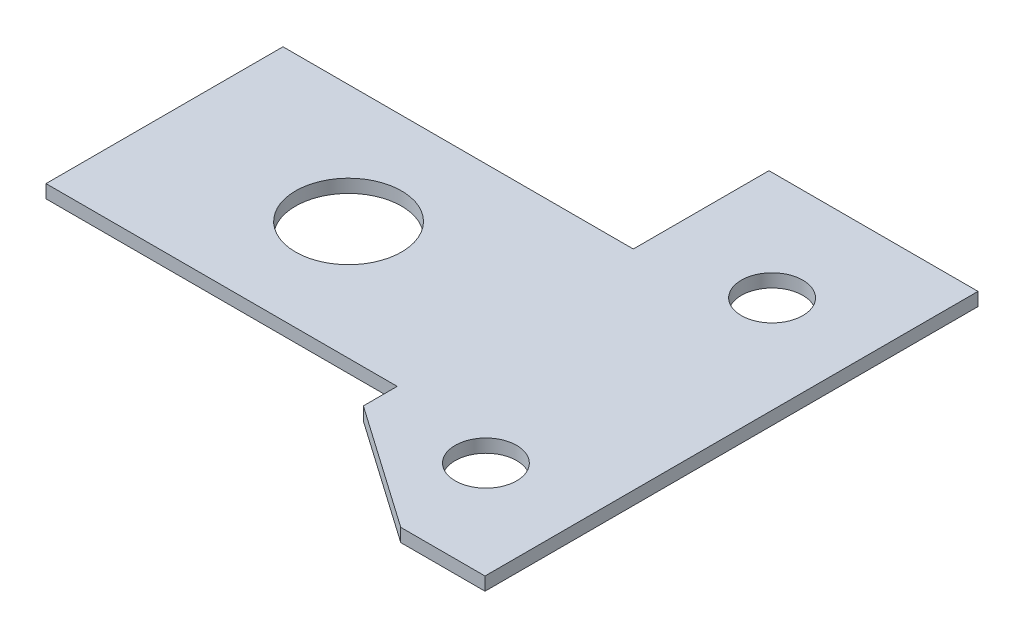
from build123d import *

# Parameters (mm, degrees)
BASE_FLANGE1_DEPTH = 1.016
SKETCH6_R          = 4.075
CUT_EXTRUDE1_DEPTH = 52.680313041
CUT_EXTRUDE2_REACH = 53.68
CUT_EXTRUDE3_REACH = 53.68
SKETCH8_R          = 2.36295848


# Sheet-metal steps are written as plain solids
with BuildPart() as part:
    # Sketch1 → Base-Flange1 (new body)
    with BuildSketch(Plane(origin=(0, 0, 0), x_dir=(1, 0, 0), z_dir=(0, 1, 0))):
        Polygon((27, 0), (27, -9.25), (43, -9.25), (43, -1.78), (43, 18.22), (43, 28.65), (26.93, 28.65), (26.93, 18.22), (0, 18.22), (0, 0), align=None)
    extrude(amount=-BASE_FLANGE1_DEPTH)

    # Sketch6 → Cut-Extrude1 (cut, through all)
    with BuildSketch(Plane(origin=(0, 0, 0), x_dir=(1, 0, 0), z_dir=(0, 1, 0))):
        with Locations(Location((14.15, 9.11, 0), (0, 0, 270))):
            Circle(SKETCH6_R)
    extrude(amount=-CUT_EXTRUDE1_DEPTH, mode=Mode.SUBTRACT)

    # Sketch7 → Cut-Extrude2 (cut, up to next)
    with BuildSketch(Plane(origin=(0, 0, 0), x_dir=(1, 0, 0), z_dir=(0, 1, 0)), mode=Mode.PRIVATE) as cut_extrude2_sk1:
        Polygon((36.522343865, -9.25), (27, -2.599722771), (27, -9.25), align=None)
    cut_extrude2_tool1 = extrude(cut_extrude2_sk1.sketch, amount=-CUT_EXTRUDE2_REACH, mode=Mode.PRIVATE) & part.part
    add(cut_extrude2_tool1.solids().sort_by_distance((30.174115, 0, 7.033241))[0], mode=Mode.SUBTRACT)

    # Sketch8 → Cut-Extrude3 (cut, up to next)
    with BuildSketch(Plane(origin=(0, 0, 0), x_dir=(1, 0, 0), z_dir=(0, 1, 0)), mode=Mode.PRIVATE) as cut_extrude3_sk1:
        with Locations(Location((35.518210435, -1.697952117, 0), (0, 0, 270))):
            Circle(SKETCH8_R)
    cut_extrude3_tool1 = extrude(cut_extrude3_sk1.sketch, amount=-CUT_EXTRUDE3_REACH, mode=Mode.PRIVATE) & part.part
    # Sketch8 → Cut-Extrude3 (cut, up to next)
    with BuildSketch(Plane(origin=(0, 0, 0), x_dir=(1, 0, 0), z_dir=(0, 1, 0)), mode=Mode.PRIVATE) as cut_extrude3_sk2:
        with Locations(Location((35.518210435, 20.302047883, 0), (0, 0, 270))):
            Circle(SKETCH8_R)
    cut_extrude3_tool2 = extrude(cut_extrude3_sk2.sketch, amount=-CUT_EXTRUDE3_REACH, mode=Mode.PRIVATE) & part.part
    add(cut_extrude3_tool1.solids().sort_by_distance((35.51821, 0, 1.697952))[0], mode=Mode.SUBTRACT)
    add(cut_extrude3_tool2.solids().sort_by_distance((35.51821, 0, -20.302048))[0], mode=Mode.SUBTRACT)


solid = part.part
